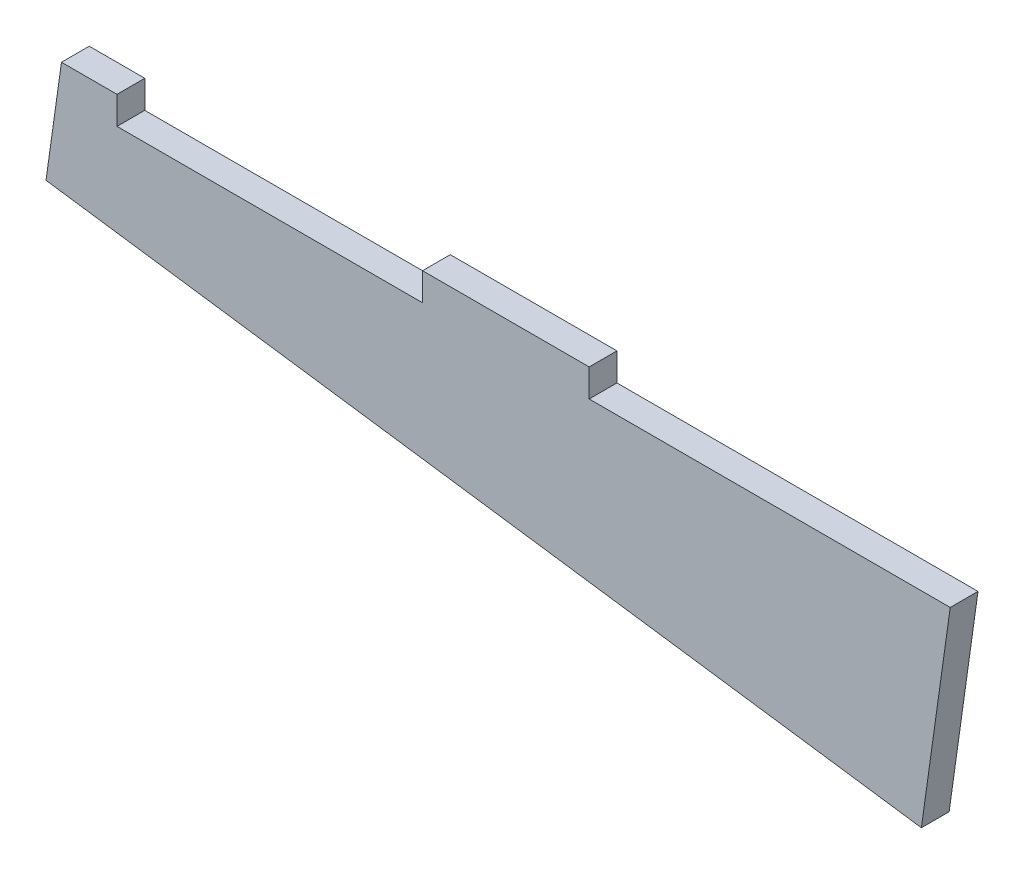
from build123d import *

# Parameters (mm, degrees)
BOSS_EXTRUDE1_DEPTH = 6.35


with BuildPart() as part:
    # Sketch1 → Boss-Extrude1 (new body)
    with BuildSketch(Plane.XY):
        Polygon((-194.066440139, -59.262896225), (-181.366440139, -59.262896225), (-181.366440139, -65.612896225), (-111.516440139, -65.612896225), (-111.516440139, -59.262896225), (-73.416440139, -59.262896225), (-73.416440139, -65.612896225), (9.133559861, -65.612896225), (2.537900009, -112.543454638), (-197.601436903, -84.415705171), align=None)
    extrude(amount=-BOSS_EXTRUDE1_DEPTH)


solid = part.part
